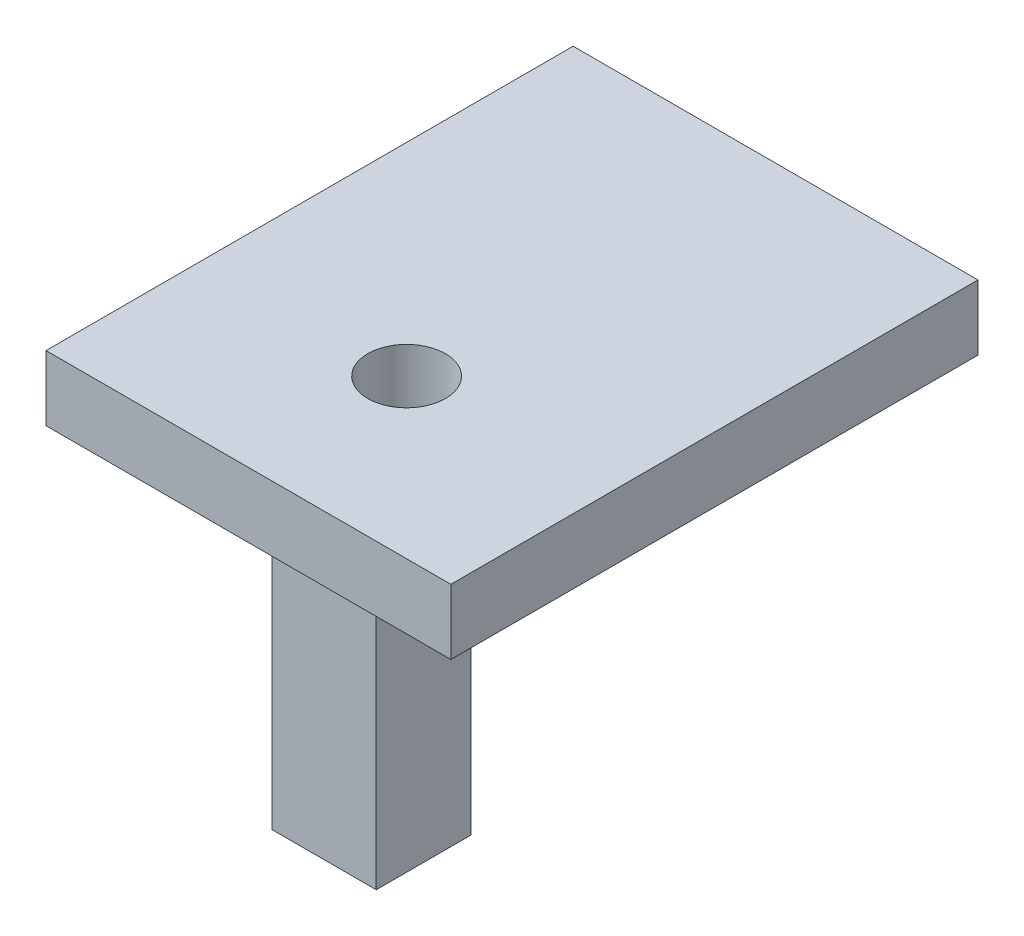
from build123d import *

# Parameters (mm, degrees)
SKETCH1_W           = 62.2
SKETCH1_H           = 80.98413
BOSS_EXTRUDE1_DEPTH = 10
SKETCH2_R           = 5.969
CUT_EXTRUDE1_DEPTH  = 10
SKETCH3_W           = 16
SKETCH3_H           = 14.55264
BOSS_EXTRUDE2_DEPTH = 71.11


with BuildPart() as part:
    # Sketch1 → Boss-Extrude1 (new body)
    with BuildSketch(Plane(origin=(0, 0, 0), x_dir=(1, 0, 0), z_dir=(0, 1, 0))):
        Rectangle(SKETCH1_W, SKETCH1_H)
    extrude(amount=BOSS_EXTRUDE1_DEPTH)

    # Sketch2 → Cut-Extrude1 (cut)
    with BuildSketch(Plane(origin=(0, 10, 0), x_dir=(1, 0, 0), z_dir=(0, 1, 0))):
        with Locations((0, -16.192065)):
            Circle(SKETCH2_R)
    extrude(amount=-CUT_EXTRUDE1_DEPTH, mode=Mode.SUBTRACT)

    # Sketch3 → Boss-Extrude2 (add)
    with BuildSketch(Plane.XZ):
        with Locations((-23.1, -1.515745)):
            Rectangle(SKETCH3_W, SKETCH3_H)
    extrude(amount=BOSS_EXTRUDE2_DEPTH)


solid = part.part
